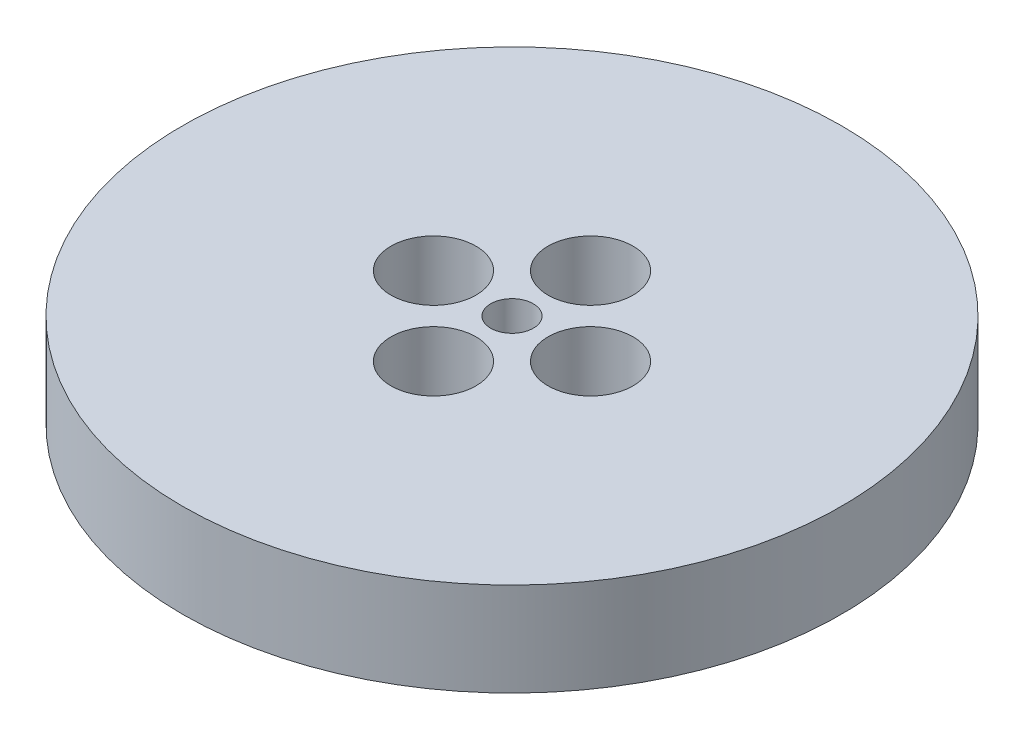
from build123d import *

# Parameters (mm, degrees)
SKETCH1_R           = 77.5
BOSS_EXTRUDE1_DEPTH = 22
SKETCH2_R           = 5
CUT_EXTRUDE1_DEPTH  = 112.787745303
SKETCH3_R           = 10
CUT_EXTRUDE2_DEPTH  = 16.571082055
CIRPATTERN1_COUNT   = 4


with BuildPart() as part:
    # Sketch1 → Boss-Extrude1 (new body)
    with BuildSketch(Plane(origin=(0, 0, 0), x_dir=(1, 0, 0), z_dir=(0, 1, 0))):
        Circle(SKETCH1_R)
    extrude(amount=BOSS_EXTRUDE1_DEPTH)

    # Sketch2 → Cut-Extrude1 (cut, through all)
    with BuildSketch(Plane(origin=(0, 0, 0), x_dir=(1, 0, 0), z_dir=(0, 1, 0))):
        Circle(SKETCH2_R)
    extrude(amount=CUT_EXTRUDE1_DEPTH, mode=Mode.SUBTRACT)

    # Sketch3 → Cut-Extrude2 (cut)
    with BuildSketch(Plane(origin=(0, 22, 0), x_dir=(1, 0, 0), z_dir=(0, 1, 0))):
        with Locations((-18.470166118, 0)):
            Circle(SKETCH3_R)
    cut_extrude2 = extrude(amount=-CUT_EXTRUDE2_DEPTH, mode=Mode.SUBTRACT)

    # CirPattern1: Cut-Extrude2 ×4 about axis
    cirpattern1_axis = Axis((0, 0, 0), (0, 1, 0))
    for i in range(1, CIRPATTERN1_COUNT):
        add(cut_extrude2.rotate(cirpattern1_axis, i * 360 / CIRPATTERN1_COUNT), mode=Mode.SUBTRACT)


solid = part.part
